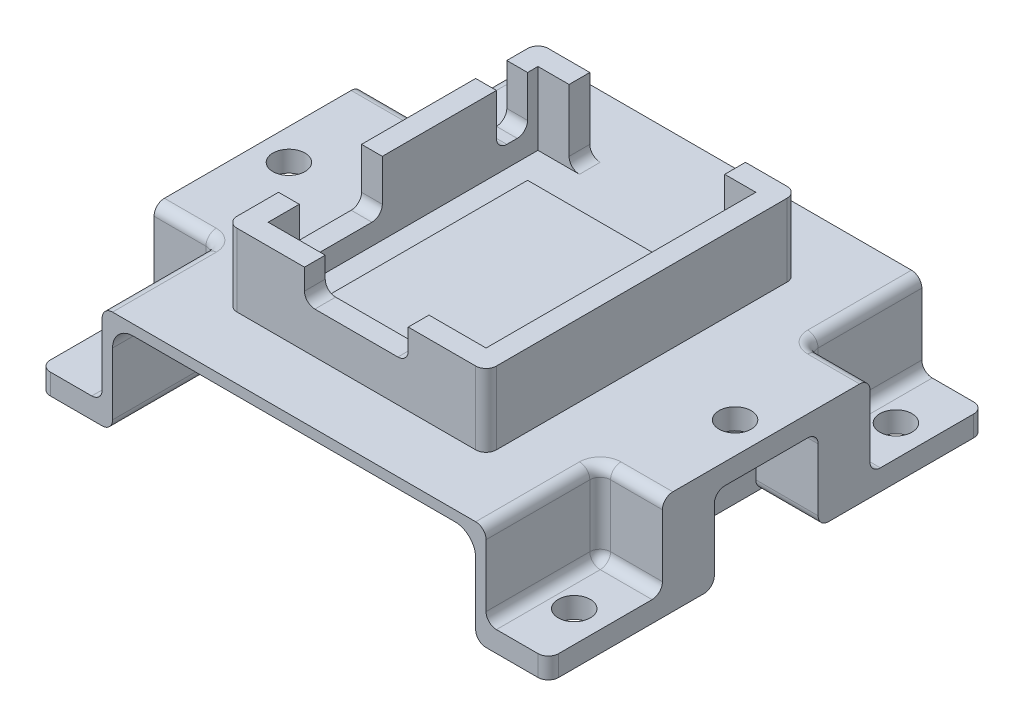
from build123d import *

# Parameters (mm, degrees)
SKETCH1_W                 = 23
SKETCH1_H                 = 28
SKETCH1_W_2               = 20
SKETCH1_H_2               = 25
BOSS_EXTRUDE1_DEPTH       = 5
SKETCH1_3_W               = 20
SKETCH1_3_H               = 25
BOSS_EXTRUDE2_DEPTH       = 1.5
SKETCH3_W                 = 5
SKETCH3_H                 = 3.5
CUT_EXTRUDE1_DEPTH        = 5
BOSS_EXTRUDE3_DEPTH       = 10
BOSS_EXTRUDE3_2_DEPTH     = 10
SKETCH4_4_W               = 35
SKETCH4_4_H               = 1
SKETCH4_4_H_2             = 40
SKETCH4_4_W_2             = 23
SKETCH4_4_H_3             = 28
BOSS_EXTRUDE4_DEPTH       = 1
SKETCH5_W                 = 42
SKETCH5_H                 = 2
BOSS_EXTRUDE5_DEPTH       = 6
CUT_EXTRUDE2_DEPTH        = 50.641212717
CUT_EXTRUDE3_DEPTH        = 10
SKETCH7_3_W               = 6
SKETCH7_3_H               = 20
SKETCH7_3_R               = 1.55
BOSS_EXTRUDE6_DEPTH       = 2
CUT_EXTRUDE4_DEPTH        = 2
SKETCH9_W                 = 2
SKETCH9_H                 = 11
BOSS_EXTRUDE7_DEPTH       = 7
BOSS_EXTRUDE8_DEPTH       = 3
SKETCH9_4_W               = 2
SKETCH9_4_H               = 3
SKETCH9_4_H_2             = 8
BOSS_EXTRUDE9_DEPTH       = 2
SKETCH9_5_W               = 10
SKETCH9_5_H               = 2
BOSS_EXTRUDE10_DEPTH      = 4
SKETCH10_W                = 6
SKETCH10_H                = 2
SKETCH10_H_2              = 6
BOSS_EXTRUDE11_DEPTH      = 5
FILLET1_R                 = 1
FILLET2_R                 = 2
FILLET3_R                 = 1
MIRROR4_COPY_1_SKETCH_W   = 6
MIRROR4_COPY_1_SKETCH_H   = 2
MIRROR4_COPY_1_SKETCH_H_2 = 6
MIRROR4_COPY_1_DEPTH      = 5
FILLET4_R                 = 1
FILLET5_R                 = 1
FILLET6_R                 = 1


with BuildPart() as part:
    # Sketch1 → Boss-Extrude1 (new body)
    with BuildSketch(Plane(origin=(0, 0, 0), x_dir=(1, 0, 0), z_dir=(0, 1, 0))):
        Rectangle(SKETCH1_W, SKETCH1_H)
        Rectangle(SKETCH1_W_2, SKETCH1_H_2, mode=Mode.SUBTRACT)
    extrude(amount=BOSS_EXTRUDE1_DEPTH)

    # Sketch1<3> → Boss-Extrude2 (add)
    with BuildSketch(Plane(origin=(0, 0, 0), x_dir=(1, 0, 0), z_dir=(0, 1, 0))):
        Rectangle(SKETCH1_3_W, SKETCH1_3_H)
    extrude(amount=BOSS_EXTRUDE2_DEPTH)

    # Sketch3 → Cut-Extrude1 (cut)
    with BuildSketch(Plane.XY.offset(14)):
        with Locations((-2.5, 3.25)):
            Rectangle(SKETCH3_W, SKETCH3_H)
        with Locations((2.5, 3.25)):
            Rectangle(SKETCH3_W, SKETCH3_H)
    extrude(amount=-CUT_EXTRUDE1_DEPTH, mode=Mode.SUBTRACT)



with BuildPart() as body_2:
    # Sketch4 → Boss-Extrude3 (new body)
    with BuildSketch(Plane.XZ):
        Polygon((-17.5, 20), (-17.5, 21), (-18.5, 21), (-18.5, -21), (-17.5, -21), (-17.5, -20), align=None)
    extrude(amount=BOSS_EXTRUDE3_DEPTH)


with BuildPart() as body_3:
    # Sketch4 → Boss-Extrude3 2 (new body)
    with BuildSketch(Plane.XZ):
        Polygon((18.5, -21), (18.5, 21), (17.5, 21), (17.5, 20), (17.5, -20), (17.5, -21), align=None)
    extrude(amount=BOSS_EXTRUDE3_2_DEPTH)


with BuildPart() as part_1:
    add(part.part)

    add(body_2.part)  # Boss-Extrude4 merges body 2

    add(body_3.part)  # Boss-Extrude4 merges body 3
    # Sketch4<4> → Boss-Extrude4 (add)
    # profile 1 of 4: a face of its own
    with BuildSketch(Plane.XZ):
        with Locations((0, 20.5)):
            Rectangle(SKETCH4_4_W, SKETCH4_4_H)
    # profile 2 of 4: a face of its own
    with BuildSketch(Plane.XZ):
        Rectangle(SKETCH4_4_W, SKETCH4_4_H_2)
        Rectangle(SKETCH4_4_W_2, SKETCH4_4_H_3, mode=Mode.SUBTRACT)
    # profile 3 of 4: a face of its own
    with BuildSketch(Plane.XZ):
        Rectangle(SKETCH4_4_W_2, SKETCH4_4_H_3)
    # profile 4 of 4: a face of its own
    with BuildSketch(Plane.XZ):
        with Locations((0, -20.5)):
            Rectangle(SKETCH4_4_W, SKETCH4_4_H)
    extrude(amount=BOSS_EXTRUDE4_DEPTH)

    # Sketch5 → Boss-Extrude5 (add)
    with BuildSketch(Plane.ZY.offset(18.5)):
        with Locations((0, -9)):
            Rectangle(SKETCH5_W, SKETCH5_H)
    boss_extrude5 = extrude(amount=BOSS_EXTRUDE5_DEPTH)

    # Mirror1: Boss-Extrude5 across plane
    add(boss_extrude5.mirror(Plane(origin=(0, 0, 0), x_dir=(0, 0, 1), z_dir=(1, 0, 0))))

    # Sketch6 → Cut-Extrude2 (cut, through all)
    with BuildSketch(Plane.XY.offset(21)):
        Polygon((-18.5, 30), (-18.5, 0), (18.5, 0), (19.5, 0), (19.5, 30), align=None)
    extrude(amount=-CUT_EXTRUDE2_DEPTH, mode=Mode.SUBTRACT)

    # Sketch7 → Cut-Extrude3 (cut)
    with BuildSketch(Plane(origin=(0, 0, 0), x_dir=(1, 0, 0), z_dir=(0, 1, 0))):
        with BuildLine():
            ThreePointArc((21.054610777, 1.484630742), (22.425242321, 1.243554039), (23.05, 0))
            Line((23.05, 0), (24.5, 0))
            Line((24.5, 0), (24.5, 10))
            Line((24.5, 10), (18.5, 10))
            Line((18.5, 10), (21.054610777, 1.484630742))
        make_face()
        with BuildLine():
            Line((24.5, 0), (23.05, 0))
            ThreePointArc((23.05, 0), (22.743554039, -0.925242321), (21.945389223, -1.484630742))
            Line((21.945389223, -1.484630742), (24.5, -10))
            Line((24.5, -10), (24.5, 0))
        make_face()
        with BuildLine():
            ThreePointArc((19.95, 0), (20.256445961, 0.925242321), (21.054610777, 1.484630742))
            Line((21.054610777, 1.484630742), (18.5, 10))
            Line((18.5, 10), (18.5, 0))
            Line((18.5, 0), (19.95, 0))
        make_face()
        with BuildLine():
            ThreePointArc((21.945389223, -1.484630742), (22.743554039, -0.925242321), (23.05, 0))
            Line((23.05, 0), (21.5, 0))
            Line((21.5, 0), (21.945389223, -1.484630742))
        make_face()
        with BuildLine():
            Line((21.5, 0), (23.05, 0))
            ThreePointArc((23.05, 0), (22.425242321, 1.243554039), (21.054610777, 1.484630742))
            Line((21.054610777, 1.484630742), (21.5, 0))
        make_face()
        with BuildLine():
            Line((21.945389223, -1.484630742), (21.5, 0))
            Line((21.5, 0), (19.95, 0))
            ThreePointArc((19.95, 0), (20.574757679, -1.243554039), (21.945389223, -1.484630742))
        make_face()
        with BuildLine():
            Line((19.95, 0), (21.5, 0))
            Line((21.5, 0), (21.054610777, 1.484630742))
            ThreePointArc((21.054610777, 1.484630742), (20.256445961, 0.925242321), (19.95, 0))
        make_face()
        with BuildLine():
            ThreePointArc((-19.95, 0), (-20.256445961, 0.925242321), (-21.054610777, 1.484630742))
            Line((-21.054610777, 1.484630742), (-21.5, 0))
            Line((-21.5, 0), (-19.95, 0))
        make_face()
        with BuildLine():
            Line((-21.5, 0), (-21.054610777, 1.484630742))
            ThreePointArc((-21.054610777, 1.484630742), (-22.425242321, 1.243554039), (-23.05, 0))
            Line((-23.05, 0), (-21.5, 0))
        make_face()
        with BuildLine():
            ThreePointArc((-21.945389223, -1.484630742), (-20.574757679, -1.243554039), (-19.95, 0))
            Line((-19.95, 0), (-21.5, 0))
            Line((-21.5, 0), (-21.945389223, -1.484630742))
        make_face()
        with BuildLine():
            Line((-21.945389223, -1.484630742), (-21.5, 0))
            Line((-21.5, 0), (-23.05, 0))
            ThreePointArc((-23.05, 0), (-22.743554039, -0.925242321), (-21.945389223, -1.484630742))
        make_face()
        with BuildLine():
            Line((-18.5, 0), (-18.5, 10))
            Line((-18.5, 10), (-21.054610777, 1.484630742))
            ThreePointArc((-21.054610777, 1.484630742), (-20.256445961, 0.925242321), (-19.95, 0))
            Line((-19.95, 0), (-18.5, 0))
        make_face()
        with BuildLine():
            Line((-24.5, -10), (-18.5, -10))
            Line((-18.5, -10), (-18.5, 0))
            Line((-18.5, 0), (-19.95, 0))
            ThreePointArc((-19.95, 0), (-20.574757679, -1.243554039), (-21.945389223, -1.484630742))
            Line((-21.945389223, -1.484630742), (-24.5, -10))
        make_face()
        with BuildLine():
            Line((-24.5, 0), (-24.5, -10))
            Line((-24.5, -10), (-21.945389223, -1.484630742))
            ThreePointArc((-21.945389223, -1.484630742), (-22.743554039, -0.925242321), (-23.05, 0))
            Line((-23.05, 0), (-24.5, 0))
        make_face()
        with BuildLine():
            Line((24.5, -10), (21.945389223, -1.484630742))
            ThreePointArc((21.945389223, -1.484630742), (20.574757679, -1.243554039), (19.95, 0))
            Line((19.95, 0), (18.5, 0))
            Line((18.5, 0), (18.5, -10))
            Line((18.5, -10), (24.5, -10))
        make_face()
        with BuildLine():
            Line((-21.054610777, 1.484630742), (-18.5, 10))
            Line((-18.5, 10), (-24.5, 10))
            Line((-24.5, 10), (-24.5, 0))
            Line((-24.5, 0), (-23.05, 0))
            ThreePointArc((-23.05, 0), (-22.425242321, 1.243554039), (-21.054610777, 1.484630742))
        make_face()
    extrude(amount=-CUT_EXTRUDE3_DEPTH, mode=Mode.SUBTRACT)

    # Sketch7<3> → Boss-Extrude6 (add)
    # profile 1 of 2: a face of its own
    with BuildSketch(Plane(origin=(0, 0, 0), x_dir=(1, 0, 0), z_dir=(0, 1, 0))):
        with Locations((21.5, 0)):
            Rectangle(SKETCH7_3_W, SKETCH7_3_H)
        with Locations(Location((21.5, 0, 0), (0, 0, 270))):
            Circle(SKETCH7_3_R, mode=Mode.SUBTRACT)
    # profile 2 of 2: a face of its own
    with BuildSketch(Plane(origin=(0, 0, 0), x_dir=(1, 0, 0), z_dir=(0, 1, 0))):
        with Locations((-21.5, 0)):
            Rectangle(SKETCH7_3_W, SKETCH7_3_H)
        with Locations(Location((-21.5, 0, 0), (0, 0, 270))):
            Circle(SKETCH7_3_R, mode=Mode.SUBTRACT)
    extrude(amount=-BOSS_EXTRUDE6_DEPTH)

    # Sketch8 → Cut-Extrude4 (cut)
    with BuildSketch(Plane.XZ.offset(10)):
        with BuildLine():
            ThreePointArc((20.757779197, 16.860738138), (19.95, 15.5), (20.757779197, 14.139261862))
            Line((20.757779197, 14.139261862), (21.5, 15.5))
            Line((21.5, 15.5), (20.757779197, 16.860738138))
        make_face()
        with BuildLine():
            Line((21.5, 15.5), (20.757779197, 14.139261862))
            ThreePointArc((20.757779197, 14.139261862), (21.5, 13.95), (22.242220803, 14.139261862))
            Line((22.242220803, 14.139261862), (21.5, 15.5))
        make_face()
        with BuildLine():
            ThreePointArc((22.242220803, 16.860738138), (21.5, 17.05), (20.757779197, 16.860738138))
            Line((20.757779197, 16.860738138), (21.5, 15.5))
            Line((21.5, 15.5), (22.242220803, 16.860738138))
        make_face()
        with BuildLine():
            Line((22.242220803, 16.860738138), (21.5, 15.5))
            Line((21.5, 15.5), (22.242220803, 14.139261862))
            ThreePointArc((22.242220803, 14.139261862), (22.832843247, 14.708780133), (23.05, 15.5))
            ThreePointArc((23.05, 15.5), (22.832843247, 16.291219867), (22.242220803, 16.860738138))
        make_face()
        with BuildLine():
            ThreePointArc((22.242220803, -14.139261862), (21.5, -13.95), (20.757779197, -14.139261862))
            Line((20.757779197, -14.139261862), (21.5, -15.5))
            Line((21.5, -15.5), (22.242220803, -14.139261862))
        make_face()
        with BuildLine():
            Line((21.5, -15.5), (20.757779197, -14.139261862))
            ThreePointArc((20.757779197, -14.139261862), (19.95, -15.5), (20.757779197, -16.860738138))
            Line((20.757779197, -16.860738138), (21.5, -15.5))
        make_face()
        with BuildLine():
            Line((21.5, -15.5), (20.757779197, -16.860738138))
            ThreePointArc((20.757779197, -16.860738138), (21.5, -17.05), (22.242220803, -16.860738138))
            Line((22.242220803, -16.860738138), (21.5, -15.5))
        make_face()
        with BuildLine():
            Line((22.242220803, -14.139261862), (21.5, -15.5))
            Line((21.5, -15.5), (22.242220803, -16.860738138))
            ThreePointArc((22.242220803, -16.860738138), (22.832843247, -16.291219867), (23.05, -15.5))
            ThreePointArc((23.05, -15.5), (22.832843247, -14.708780133), (22.242220803, -14.139261862))
        make_face()
    cut_extrude4 = extrude(amount=-CUT_EXTRUDE4_DEPTH, mode=Mode.SUBTRACT)

    # Mirror2: Cut-Extrude4 across plane
    add(cut_extrude4.mirror(Plane(origin=(0, 0, 0), x_dir=(0, 0, 1), z_dir=(1, 0, 0))), mode=Mode.SUBTRACT)

    # Sketch9 → Boss-Extrude7 (add)
    with BuildSketch(Plane(origin=(0, 0, 0), x_dir=(1, 0, 0), z_dir=(0, 1, 0))):
        Polygon((-12.5, 15), (-12.5, 12), (-10.5, 12), (-10.5, 13), (-7.5, 13), (-7.5, 15), align=None)
        with Locations((-11.5, 3.5)):
            Rectangle(SKETCH9_W, SKETCH9_H)
        Polygon((-12.5, -10), (-12.5, -15), (-5, -15), (-5, -13), (-5.5, -13), (-10.5, -13), (-10.5, -10), align=None)
        Polygon((5, -13), (5, -15), (12.5, -15), (12.5, 15), (7.5, 15), (7.5, 13), (10.5, 13), (10.5, 7), (10.5, -13), align=None)
    extrude(amount=BOSS_EXTRUDE7_DEPTH)

    # Sketch9<3> → Boss-Extrude8 (add)
    with BuildSketch(Plane(origin=(0, 0, 0), x_dir=(1, 0, 0), z_dir=(0, 1, 0))):
        Polygon((-5.5, -13), (-5, -13), (5, -13), (10.5, -13), (10.5, 7), (-5.5, 7), align=None)
    extrude(amount=BOSS_EXTRUDE8_DEPTH)

    # Sketch9<4> → Boss-Extrude9 (add)
    with BuildSketch(Plane(origin=(0, 0, 0), x_dir=(1, 0, 0), z_dir=(0, 1, 0))):
        with Locations((-11.5, 10.5)):
            Rectangle(SKETCH9_4_W, SKETCH9_4_H)
        with Locations((-11.5, -6)):
            Rectangle(SKETCH9_4_W, SKETCH9_4_H_2)
    extrude(amount=BOSS_EXTRUDE9_DEPTH)

    # Sketch9<5> → Boss-Extrude10 (add)
    with BuildSketch(Plane(origin=(0, 0, 0), x_dir=(1, 0, 0), z_dir=(0, 1, 0))):
        with Locations((0, -14)):
            Rectangle(SKETCH9_5_W, SKETCH9_5_H)
    extrude(amount=BOSS_EXTRUDE10_DEPTH)

    # Sketch10 → Boss-Extrude11 (add)
    with BuildSketch(Plane.XY.offset(-10)):
        with Locations((-21.5, -9)):
            Rectangle(SKETCH10_W, SKETCH10_H)
        with Locations((-21.5, -5)):
            Rectangle(SKETCH10_W, SKETCH10_H_2)
    boss_extrude11 = extrude(amount=BOSS_EXTRUDE11_DEPTH)

    # Fillet1
    fillet1_edges = [part_1.edges().sort_by_distance(p)[0] for p in [
        (-18.5, -8, -15.5),
        (-21.5, -8, -10),
        (-18.5, -4, -10),
    ]]
    fillet(fillet1_edges, radius=FILLET1_R)

    # Fillet2
    fillet2_edges = [part_1.edges().sort_by_distance(p)[0] for p in [
        (-17.5, -1, 0),
        (17.5, -1, 0),
    ]]
    fillet(fillet2_edges, radius=FILLET2_R)

    # Fillet3
    fillet3_edges = [part_1.edges().sort_by_distance(p)[0] for p in [
        (-17.5, -10, 0),
        (17.5, -10, 0),
    ]]
    fillet(fillet3_edges, radius=FILLET3_R - 0.0001)  # a hair under: the kernel refuses the full size

    # Mirror3: Boss-Extrude11 across plane
    add(boss_extrude11.mirror(Plane.XY))

    # Mirror4: Boss-Extrude11 across plane
    add(boss_extrude11.mirror(Plane(origin=(0, 0, 0), x_dir=(0, 0, 1), z_dir=(1, 0, 0))))

    # Mirror4 copy 1 sketch → Mirror4 copy 1 (add)
    with BuildSketch(Plane(origin=(0, 0, 10), x_dir=(-1, 0, 0), z_dir=(0, 0, -1))):
        with Locations((-21.5, -9)):
            Rectangle(MIRROR4_COPY_1_SKETCH_W, MIRROR4_COPY_1_SKETCH_H)
        with Locations((-21.5, -5)):
            Rectangle(MIRROR4_COPY_1_SKETCH_W, MIRROR4_COPY_1_SKETCH_H_2)
    extrude(amount=MIRROR4_COPY_1_DEPTH)

    # Fillet4
    fillet4_edges = [part_1.edges().sort_by_distance(p)[0] for p in [
        (18.5, -8, -15.5),
        (18.5, -8, 15.5),
        (-18.5, -8, 15.5),
        (21.5, -8, -10),
        (21.5, -8, 10),
        (-21.5, -8, 10),
        (18.5, 0, 15.5),
        (18.5, -4, -10),
        (21.5, 0, 10),
        (18.5, -4, 10),
        (21.5, 0, -10),
        (-18.5, 0, 15.5),
        (-21.5, 0, 10),
        (-18.5, -4, 10),
        (-22, 0, -10),
        (-18.792893219, 0, -10.292893219),
        (-18.5, 0, -16),
        (18.5, 0, -15.5),
    ]]
    fillet(fillet4_edges, radius=FILLET4_R)

    # Fillet5
    fillet5_edges = [part_1.edges().sort_by_distance(p)[0] for p in [
        (-24.5, -9, -21),
        (-24.5, -9, 21),
        (24.5, -9, 21),
        (24.5, -9, -21),
        (-21.5, -2, -5),
        (-21.5, -10, -5),
        (-21.5, -10, 5),
        (-21.5, -2, 5),
        (21.5, -2, 5),
        (21.5, -10, 5),
        (21.5, -10, -5),
        (21.5, -2, -5),
    ]]
    fillet(fillet5_edges, radius=FILLET5_R)

    # Fillet6
    fillet6_edges = [part_1.edges().sort_by_distance(p)[0] for p in [
        (-12.5, 3.5, -15),
        (-7.5, 0, -14),
        (-12.5, 3.5, 15),
        (12.5, 3.5, 15),
        (12.5, 3.5, -15),
        (7.5, 0, -14),
        (-11.5, 2, -9),
        (-11.5, 2, -12),
        (-11.5, 2, 2),
        (-11.5, 2, 10),
        (-5, 4, 14),
        (5, 4, 14),
    ]]
    fillet(fillet6_edges, radius=FILLET6_R)


solid = part_1.part
